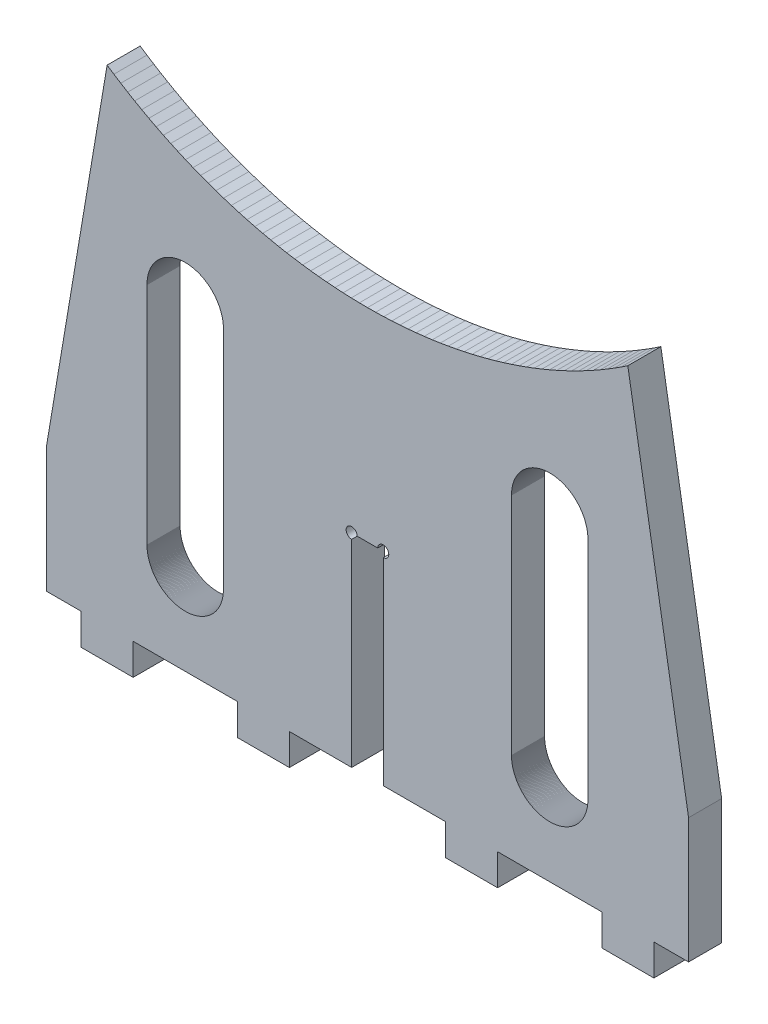
from build123d import *

# Parameters (mm, degrees)
BOSS_EXTRUDE1_DEPTH = 19.05


with BuildPart() as part:
    # Model → Boss-Extrude1 (new body)
    with BuildSketch(Plane.XY):
        with BuildLine():
            Line((4.683123656, 252.04098688), (0, 252))
            Line((0, 252), (-4.683123656, 252.04098688))
            Line((-4.683123656, 252.04098688), (-9.364812547, 252.163934964))
            Line((-9.364812547, 252.163934964), (-14.043632346, 252.368806584))
            Line((-14.043632346, 252.368806584), (-18.718149609, 252.655538974))
            Line((-18.718149609, 252.655538974), (-23.386932206, 253.024044287))
            Line((-23.386932206, 253.024044287), (-28.048549765, 253.474209626))
            Line((-28.048549765, 253.474209626), (-32.70157411, 254.005897072))
            Line((-32.70157411, 254.005897072), (-37.344579698, 254.618943734))
            Line((-37.344579698, 254.618943734), (-41.976144055, 255.313161793))
            Line((-41.976144055, 255.313161793), (-46.59484821, 256.088338561))
            Line((-46.59484821, 256.088338561), (-51.199277136, 256.944236549))
            Line((-51.199277136, 256.944236549), (-55.788020177, 257.880593536))
            Line((-55.788020177, 257.880593536), (-60.359671483, 258.89712265))
            Line((-60.359671483, 258.89712265), (-64.91283044, 259.993512458))
            Line((-64.91283044, 259.993512458), (-69.446102101, 261.16942706))
            Line((-69.446102101, 261.16942706), (-73.958097609, 262.424506193))
            Line((-73.958097609, 262.424506193), (-78.44743463, 263.758365338))
            Line((-78.44743463, 263.758365338), (-82.912737767, 265.170595841))
            Line((-82.912737767, 265.170595841), (-87.352638989, 266.66076504))
            Line((-87.352638989, 266.66076504), (-91.765778046, 268.228416391))
            Line((-91.765778046, 268.228416391), (-96.150802889, 269.873069615))
            Line((-96.150802889, 269.873069615), (-100.506370081, 271.59422084))
            Line((-100.506370081, 271.59422084), (-104.831145209, 273.391342758))
            Line((-104.831145209, 273.391342758), (-109.123803296, 275.263884788))
            Line((-109.123803296, 275.263884788), (-113.383029202, 277.211273238))
            Line((-113.383029202, 277.211273238), (-117.607518033, 279.23291149))
            Line((-117.607518033, 279.23291149), (-121.795975534, 281.328180175))
            Line((-121.795975534, 281.328180175), (-125.94711849, 283.496437368))
            Line((-125.94711849, 283.496437368), (-130.05967512, 285.737018781))
            Line((-130.05967512, 285.737018781), (-134.132385462, 288.049237969))
            Line((-134.132385462, 288.049237969), (-138.164001763, 290.432386539))
            Line((-138.164001763, 290.432386539), (-142.153288859, 292.885734367))
            Line((-142.153288859, 292.885734367), (-146.099024555, 295.408529823))
            Line((-146.099024555, 295.408529823), (-150, 298))
            Line((-150, 298), (-185, 90))
            Line((-185, 90), (-185, 18))
            Line((-185, 18), (-165, 18))
            Line((-165, 18), (-165, 0))
            Line((-165, 0), (-135, 0))
            Line((-135, 0), (-135, 18))
            Line((-135, 18), (-75, 18))
            Line((-75, 18), (-75, 0))
            Line((-75, 0), (-45, 0))
            Line((-45, 0), (-45, 18))
            Line((-45, 18), (-9.1, 18))
            Line((-9.1, 18), (-9.1, 131.825))
            ThreePointArc((-9.1, 131.825), (-11.34506403, 137.24506403), (-5.925, 135))
            Line((-5.925, 135), (5.925, 135))
            ThreePointArc((5.925, 135), (9.1, 138.175), (12.275, 135))
            ThreePointArc((12.275, 135), (11.34506403, 132.75493597), (9.1, 131.825))
            Line((9.1, 131.825), (9.1, 18))
            Line((9.1, 18), (45, 18))
            Line((45, 18), (45, 0))
            Line((45, 0), (75, 0))
            Line((75, 0), (75, 18))
            Line((75, 18), (135, 18))
            Line((135, 18), (135, 0))
            Line((135, 0), (165, 0))
            Line((165, 0), (165, 18))
            Line((165, 18), (185, 18))
            Line((185, 18), (185, 90))
            Line((185, 90), (150, 298))
            Line((150, 298), (146.099024555, 295.408529823))
            Line((146.099024555, 295.408529823), (142.153288859, 292.885734367))
            Line((142.153288859, 292.885734367), (138.164001763, 290.432386539))
            Line((138.164001763, 290.432386539), (134.132385462, 288.049237969))
            Line((134.132385462, 288.049237969), (130.05967512, 285.737018781))
            Line((130.05967512, 285.737018781), (125.94711849, 283.496437368))
            Line((125.94711849, 283.496437368), (121.795975534, 281.328180175))
            Line((121.795975534, 281.328180175), (117.607518033, 279.23291149))
            Line((117.607518033, 279.23291149), (113.383029202, 277.211273238))
            Line((113.383029202, 277.211273238), (109.123803296, 275.263884788))
            Line((109.123803296, 275.263884788), (104.831145209, 273.391342758))
            Line((104.831145209, 273.391342758), (100.506370081, 271.59422084))
            Line((100.506370081, 271.59422084), (96.150802889, 269.873069615))
            Line((96.150802889, 269.873069615), (91.765778046, 268.228416391))
            Line((91.765778046, 268.228416391), (87.352638989, 266.66076504))
            Line((87.352638989, 266.66076504), (82.912737767, 265.170595841))
            Line((82.912737767, 265.170595841), (78.44743463, 263.758365338))
            Line((78.44743463, 263.758365338), (73.958097609, 262.424506193))
            Line((73.958097609, 262.424506193), (69.446102101, 261.16942706))
            Line((69.446102101, 261.16942706), (64.91283044, 259.993512458))
            Line((64.91283044, 259.993512458), (60.359671483, 258.89712265))
            Line((60.359671483, 258.89712265), (55.788020177, 257.880593536))
            Line((55.788020177, 257.880593536), (51.199277136, 256.944236549))
            Line((51.199277136, 256.944236549), (46.59484821, 256.088338561))
            Line((46.59484821, 256.088338561), (41.976144055, 255.313161793))
            Line((41.976144055, 255.313161793), (37.344579698, 254.618943734))
            Line((37.344579698, 254.618943734), (32.70157411, 254.005897072))
            Line((32.70157411, 254.005897072), (28.048549765, 253.474209626))
            Line((28.048549765, 253.474209626), (23.386932206, 253.024044287))
            Line((23.386932206, 253.024044287), (18.718149609, 252.655538974))
            Line((18.718149609, 252.655538974), (14.043632346, 252.368806584))
            Line((14.043632346, 252.368806584), (9.364812547, 252.163934964))
            Line((9.364812547, 252.163934964), (4.683123656, 252.04098688))
        make_face()
        Polygon((-83.003350707, 200.383952942), (-83, 200), (-83, 70), (-83.003350707, 69.616047058), (-83.013401806, 69.232211073), (-83.030150235, 68.848608963), (-83.053590894, 68.465357578), (-83.083716642, 68.08257366), (-83.120518302, 67.700373808), (-83.163984664, 67.318874445), (-83.214102488, 66.938191779), (-83.270856507, 66.558441769), (-83.334229434, 66.179740091), (-83.404201964, 65.802202102), (-83.480752784, 65.425942802), (-83.563858575, 65.051076804), (-83.653494022, 64.677718297), (-83.749631822, 64.305981008), (-83.852242689, 63.935978172), (-83.961295369, 63.567822496), (-84.076756642, 63.201626124), (-84.198591337, 62.837500602), (-84.326762343, 62.475556847), (-84.461230617, 62.11590511), (-84.6019552, 61.758654945), (-84.748893224, 61.403915173), (-84.901999932, 61.051793852), (-85.061228685, 60.702398242), (-85.226530981, 60.355834771), (-85.397856468, 60.012209006), (-85.575152957, 59.671625619), (-85.758366443, 59.334188355), (-85.947441117, 59), (-86.142319385, 58.669162352), (-86.342941885, 58.341776187), (-86.549247505, 58.01794123), (-86.761173404, 57.697756124), (-86.978655026, 57.3813184), (-87.201626124, 57.06872445), (-87.430018779, 56.760069491), (-87.663763421, 56.455447543), (-87.902788848, 56.154951397), (-88.147022251, 55.858672587), (-88.396389235, 55.566701362), (-88.650813839, 55.27912666), (-88.910218564, 54.996036079), (-89.174524393, 54.71751585), (-89.443650814, 54.443650814), (-89.71751585, 54.174524393), (-89.996036079, 53.910218564), (-90.27912666, 53.650813839), (-90.566701362, 53.396389235), (-90.858672587, 53.147022251), (-91.154951397, 52.902788848), (-91.455447543, 52.663763421), (-91.760069491, 52.430018779), (-92.06872445, 52.201626124), (-92.3813184, 51.978655026), (-92.697756124, 51.761173404), (-93.01794123, 51.549247505), (-93.341776187, 51.342941885), (-93.669162352, 51.142319385), (-94, 50.947441117), (-94.334188355, 50.758366443), (-94.671625619, 50.575152957), (-95.012209006, 50.397856468), (-95.355834771, 50.226530981), (-95.702398242, 50.061228685), (-96.051793852, 49.901999932), (-96.403915173, 49.748893224), (-96.758654945, 49.6019552), (-97.11590511, 49.461230617), (-97.475556847, 49.326762343), (-97.837500602, 49.198591337), (-98.201626124, 49.076756642), (-98.567822496, 48.961295369), (-98.935978172, 48.852242689), (-99.305981008, 48.749631822), (-99.677718297, 48.653494022), (-100.051076804, 48.563858575), (-100.425942802, 48.480752784), (-100.802202102, 48.404201964), (-101.179740091, 48.334229434), (-101.558441769, 48.270856507), (-101.938191779, 48.214102488), (-102.318874445, 48.163984664), (-102.700373808, 48.120518302), (-103.08257366, 48.083716642), (-103.465357578, 48.053590894), (-103.848608963, 48.030150235), (-104.232211073, 48.013401806), (-104.616047058, 48.003350707), (-105, 48), (-105.383952942, 48.003350707), (-105.767788927, 48.013401806), (-106.151391037, 48.030150235), (-106.534642422, 48.053590894), (-106.91742634, 48.083716642), (-107.299626192, 48.120518302), (-107.681125555, 48.163984664), (-108.061808221, 48.214102488), (-108.441558231, 48.270856507), (-108.820259909, 48.334229434), (-109.197797898, 48.404201964), (-109.574057198, 48.480752784), (-109.948923196, 48.563858575), (-110.322281703, 48.653494022), (-110.694018992, 48.749631822), (-111.064021828, 48.852242689), (-111.432177504, 48.961295369), (-111.798373876, 49.076756642), (-112.162499398, 49.198591337), (-112.524443153, 49.326762343), (-112.88409489, 49.461230617), (-113.241345055, 49.6019552), (-113.596084827, 49.748893224), (-113.948206148, 49.901999932), (-114.297601758, 50.061228685), (-114.644165229, 50.226530981), (-114.987790994, 50.397856468), (-115.328374381, 50.575152957), (-115.665811645, 50.758366443), (-116, 50.947441117), (-116.330837648, 51.142319385), (-116.658223813, 51.342941885), (-116.98205877, 51.549247505), (-117.302243876, 51.761173404), (-117.6186816, 51.978655026), (-117.93127555, 52.201626124), (-118.239930509, 52.430018779), (-118.544552457, 52.663763421), (-118.845048603, 52.902788848), (-119.141327413, 53.147022251), (-119.433298638, 53.396389235), (-119.72087334, 53.650813839), (-120.003963921, 53.910218564), (-120.28248415, 54.174524393), (-120.556349186, 54.443650814), (-120.825475607, 54.71751585), (-121.089781436, 54.996036079), (-121.349186161, 55.27912666), (-121.603610765, 55.566701362), (-121.852977749, 55.858672587), (-122.097211152, 56.154951397), (-122.336236579, 56.455447543), (-122.569981221, 56.760069491), (-122.798373876, 57.06872445), (-123.021344974, 57.3813184), (-123.238826596, 57.697756124), (-123.450752495, 58.01794123), (-123.657058115, 58.341776187), (-123.857680615, 58.669162352), (-124.052558883, 59), (-124.241633557, 59.334188355), (-124.424847043, 59.671625619), (-124.602143532, 60.012209006), (-124.773469019, 60.355834771), (-124.938771315, 60.702398242), (-125.098000068, 61.051793852), (-125.251106776, 61.403915173), (-125.3980448, 61.758654945), (-125.538769383, 62.11590511), (-125.673237657, 62.475556847), (-125.801408663, 62.837500602), (-125.923243358, 63.201626124), (-126.038704631, 63.567822496), (-126.147757311, 63.935978172), (-126.250368178, 64.305981008), (-126.346505978, 64.677718297), (-126.436141425, 65.051076804), (-126.519247216, 65.425942802), (-126.595798036, 65.802202102), (-126.665770566, 66.179740091), (-126.729143493, 66.558441769), (-126.785897512, 66.938191779), (-126.836015336, 67.318874445), (-126.879481698, 67.700373808), (-126.916283358, 68.08257366), (-126.946409106, 68.465357578), (-126.969849765, 68.848608963), (-126.986598194, 69.232211073), (-126.996649293, 69.616047058), (-127, 70), (-127, 200), (-126.996649293, 200.383952942), (-126.986598194, 200.767788927), (-126.969849765, 201.151391037), (-126.946409106, 201.534642422), (-126.916283358, 201.91742634), (-126.879481698, 202.299626192), (-126.836015336, 202.681125555), (-126.785897512, 203.061808221), (-126.729143493, 203.441558231), (-126.665770566, 203.820259909), (-126.595798036, 204.197797898), (-126.519247216, 204.574057198), (-126.436141425, 204.948923196), (-126.346505978, 205.322281703), (-126.250368178, 205.694018992), (-126.147757311, 206.064021828), (-126.038704631, 206.432177504), (-125.923243358, 206.798373876), (-125.801408663, 207.162499398), (-125.673237657, 207.524443153), (-125.538769383, 207.88409489), (-125.3980448, 208.241345055), (-125.251106776, 208.596084827), (-125.098000068, 208.948206148), (-124.938771315, 209.297601758), (-124.773469019, 209.644165229), (-124.602143532, 209.987790994), (-124.424847043, 210.328374381), (-124.241633557, 210.665811645), (-124.052558883, 211), (-123.857680615, 211.330837648), (-123.657058115, 211.658223813), (-123.450752495, 211.98205877), (-123.238826596, 212.302243876), (-123.021344974, 212.6186816), (-122.798373876, 212.93127555), (-122.569981221, 213.239930509), (-122.336236579, 213.544552457), (-122.097211152, 213.845048603), (-121.852977749, 214.141327413), (-121.603610765, 214.433298638), (-121.349186161, 214.72087334), (-121.089781436, 215.003963921), (-120.825475607, 215.28248415), (-120.556349186, 215.556349186), (-120.28248415, 215.825475607), (-120.003963921, 216.089781436), (-119.72087334, 216.349186161), (-119.433298638, 216.603610765), (-119.141327413, 216.852977749), (-118.845048603, 217.097211152), (-118.544552457, 217.336236579), (-118.239930509, 217.569981221), (-117.93127555, 217.798373876), (-117.6186816, 218.021344974), (-117.302243876, 218.238826596), (-116.98205877, 218.450752495), (-116.658223813, 218.657058115), (-116.330837648, 218.857680615), (-116, 219.052558883), (-115.665811645, 219.241633557), (-115.328374381, 219.424847043), (-114.987790994, 219.602143532), (-114.644165229, 219.773469019), (-114.297601758, 219.938771315), (-113.948206148, 220.098000068), (-113.596084827, 220.251106776), (-113.241345055, 220.3980448), (-112.88409489, 220.538769383), (-112.524443153, 220.673237657), (-112.162499398, 220.801408663), (-111.798373876, 220.923243358), (-111.432177504, 221.038704631), (-111.064021828, 221.147757311), (-110.694018992, 221.250368178), (-110.322281703, 221.346505978), (-109.948923196, 221.436141425), (-109.574057198, 221.519247216), (-109.197797898, 221.595798036), (-108.820259909, 221.665770566), (-108.441558231, 221.729143493), (-108.061808221, 221.785897512), (-107.681125555, 221.836015336), (-107.299626192, 221.879481698), (-106.91742634, 221.916283358), (-106.534642422, 221.946409106), (-106.151391037, 221.969849765), (-105.767788927, 221.986598194), (-105.383952942, 221.996649293), (-105, 222), (-104.616047058, 221.996649293), (-104.232211073, 221.986598194), (-103.848608963, 221.969849765), (-103.465357578, 221.946409106), (-103.08257366, 221.916283358), (-102.700373808, 221.879481698), (-102.318874445, 221.836015336), (-101.938191779, 221.785897512), (-101.558441769, 221.729143493), (-101.179740091, 221.665770566), (-100.802202102, 221.595798036), (-100.425942802, 221.519247216), (-100.051076804, 221.436141425), (-99.677718297, 221.346505978), (-99.305981008, 221.250368178), (-98.935978172, 221.147757311), (-98.567822496, 221.038704631), (-98.201626124, 220.923243358), (-97.837500602, 220.801408663), (-97.475556847, 220.673237657), (-97.11590511, 220.538769383), (-96.758654945, 220.3980448), (-96.403915173, 220.251106776), (-96.051793852, 220.098000068), (-95.702398242, 219.938771315), (-95.355834771, 219.773469019), (-95.012209006, 219.602143532), (-94.671625619, 219.424847043), (-94.334188355, 219.241633557), (-94, 219.052558883), (-93.669162352, 218.857680615), (-93.341776187, 218.657058115), (-93.01794123, 218.450752495), (-92.697756124, 218.238826596), (-92.3813184, 218.021344974), (-92.06872445, 217.798373876), (-91.760069491, 217.569981221), (-91.455447543, 217.336236579), (-91.154951397, 217.097211152), (-90.858672587, 216.852977749), (-90.566701362, 216.603610765), (-90.27912666, 216.349186161), (-89.996036079, 216.089781436), (-89.71751585, 215.825475607), (-89.443650814, 215.556349186), (-89.174524393, 215.28248415), (-88.910218564, 215.003963921), (-88.650813839, 214.72087334), (-88.396389235, 214.433298638), (-88.147022251, 214.141327413), (-87.902788848, 213.845048603), (-87.663763421, 213.544552457), (-87.430018779, 213.239930509), (-87.201626124, 212.93127555), (-86.978655026, 212.6186816), (-86.761173404, 212.302243876), (-86.549247505, 211.98205877), (-86.342941885, 211.658223813), (-86.142319385, 211.330837648), (-85.947441117, 211), (-85.758366443, 210.665811645), (-85.575152957, 210.328374381), (-85.397856468, 209.987790994), (-85.226530981, 209.644165229), (-85.061228685, 209.297601758), (-84.901999932, 208.948206148), (-84.748893224, 208.596084827), (-84.6019552, 208.241345055), (-84.461230617, 207.88409489), (-84.326762343, 207.524443153), (-84.198591337, 207.162499398), (-84.076756642, 206.798373876), (-83.961295369, 206.432177504), (-83.852242689, 206.064021828), (-83.749631822, 205.694018992), (-83.653494022, 205.322281703), (-83.563858575, 204.948923196), (-83.480752784, 204.574057198), (-83.404201964, 204.197797898), (-83.334229434, 203.820259909), (-83.270856507, 203.441558231), (-83.214102488, 203.061808221), (-83.163984664, 202.681125555), (-83.120518302, 202.299626192), (-83.083716642, 201.91742634), (-83.053590894, 201.534642422), (-83.030150235, 201.151391037), (-83.013401806, 200.767788927), align=None, mode=Mode.SUBTRACT)
        Polygon((126.996649293, 200.383952942), (127, 200), (127, 70), (126.996649293, 69.616047058), (126.986598194, 69.232211073), (126.969849765, 68.848608963), (126.946409106, 68.465357578), (126.916283358, 68.08257366), (126.879481698, 67.700373808), (126.836015336, 67.318874445), (126.785897512, 66.938191779), (126.729143493, 66.558441769), (126.665770566, 66.179740091), (126.595798036, 65.802202102), (126.519247216, 65.425942802), (126.436141425, 65.051076804), (126.346505978, 64.677718297), (126.250368178, 64.305981008), (126.147757311, 63.935978172), (126.038704631, 63.567822496), (125.923243358, 63.201626124), (125.801408663, 62.837500602), (125.673237657, 62.475556847), (125.538769383, 62.11590511), (125.3980448, 61.758654945), (125.251106776, 61.403915173), (125.098000068, 61.051793852), (124.938771315, 60.702398242), (124.773469019, 60.355834771), (124.602143532, 60.012209006), (124.424847043, 59.671625619), (124.241633557, 59.334188355), (124.052558883, 59), (123.857680615, 58.669162352), (123.657058115, 58.341776187), (123.450752495, 58.01794123), (123.238826596, 57.697756124), (123.021344974, 57.3813184), (122.798373876, 57.06872445), (122.569981221, 56.760069491), (122.336236579, 56.455447543), (122.097211152, 56.154951397), (121.852977749, 55.858672587), (121.603610765, 55.566701362), (121.349186161, 55.27912666), (121.089781436, 54.996036079), (120.825475607, 54.71751585), (120.556349186, 54.443650814), (120.28248415, 54.174524393), (120.003963921, 53.910218564), (119.72087334, 53.650813839), (119.433298638, 53.396389235), (119.141327413, 53.147022251), (118.845048603, 52.902788848), (118.544552457, 52.663763421), (118.239930509, 52.430018779), (117.93127555, 52.201626124), (117.6186816, 51.978655026), (117.302243876, 51.761173404), (116.98205877, 51.549247505), (116.658223813, 51.342941885), (116.330837648, 51.142319385), (116, 50.947441117), (115.665811645, 50.758366443), (115.328374381, 50.575152957), (114.987790994, 50.397856468), (114.644165229, 50.226530981), (114.297601758, 50.061228685), (113.948206148, 49.901999932), (113.596084827, 49.748893224), (113.241345055, 49.6019552), (112.88409489, 49.461230617), (112.524443153, 49.326762343), (112.162499398, 49.198591337), (111.798373876, 49.076756642), (111.432177504, 48.961295369), (111.064021828, 48.852242689), (110.694018992, 48.749631822), (110.322281703, 48.653494022), (109.948923196, 48.563858575), (109.574057198, 48.480752784), (109.197797898, 48.404201964), (108.820259909, 48.334229434), (108.441558231, 48.270856507), (108.061808221, 48.214102488), (107.681125555, 48.163984664), (107.299626192, 48.120518302), (106.91742634, 48.083716642), (106.534642422, 48.053590894), (106.151391037, 48.030150235), (105.767788927, 48.013401806), (105.383952942, 48.003350707), (105, 48), (104.616047058, 48.003350707), (104.232211073, 48.013401806), (103.848608963, 48.030150235), (103.465357578, 48.053590894), (103.08257366, 48.083716642), (102.700373808, 48.120518302), (102.318874445, 48.163984664), (101.938191779, 48.214102488), (101.558441769, 48.270856507), (101.179740091, 48.334229434), (100.802202102, 48.404201964), (100.425942802, 48.480752784), (100.051076804, 48.563858575), (99.677718297, 48.653494022), (99.305981008, 48.749631822), (98.935978172, 48.852242689), (98.567822496, 48.961295369), (98.201626124, 49.076756642), (97.837500602, 49.198591337), (97.475556847, 49.326762343), (97.11590511, 49.461230617), (96.758654945, 49.6019552), (96.403915173, 49.748893224), (96.051793852, 49.901999932), (95.702398242, 50.061228685), (95.355834771, 50.226530981), (95.012209006, 50.397856468), (94.671625619, 50.575152957), (94.334188355, 50.758366443), (94, 50.947441117), (93.669162352, 51.142319385), (93.341776187, 51.342941885), (93.01794123, 51.549247505), (92.697756124, 51.761173404), (92.3813184, 51.978655026), (92.06872445, 52.201626124), (91.760069491, 52.430018779), (91.455447543, 52.663763421), (91.154951397, 52.902788848), (90.858672587, 53.147022251), (90.566701362, 53.396389235), (90.27912666, 53.650813839), (89.996036079, 53.910218564), (89.71751585, 54.174524393), (89.443650814, 54.443650814), (89.174524393, 54.71751585), (88.910218564, 54.996036079), (88.650813839, 55.27912666), (88.396389235, 55.566701362), (88.147022251, 55.858672587), (87.902788848, 56.154951397), (87.663763421, 56.455447543), (87.430018779, 56.760069491), (87.201626124, 57.06872445), (86.978655026, 57.3813184), (86.761173404, 57.697756124), (86.549247505, 58.01794123), (86.342941885, 58.341776187), (86.142319385, 58.669162352), (85.947441117, 59), (85.758366443, 59.334188355), (85.575152957, 59.671625619), (85.397856468, 60.012209006), (85.226530981, 60.355834771), (85.061228685, 60.702398242), (84.901999932, 61.051793852), (84.748893224, 61.403915173), (84.6019552, 61.758654945), (84.461230617, 62.11590511), (84.326762343, 62.475556847), (84.198591337, 62.837500602), (84.076756642, 63.201626124), (83.961295369, 63.567822496), (83.852242689, 63.935978172), (83.749631822, 64.305981008), (83.653494022, 64.677718297), (83.563858575, 65.051076804), (83.480752784, 65.425942802), (83.404201964, 65.802202102), (83.334229434, 66.179740091), (83.270856507, 66.558441769), (83.214102488, 66.938191779), (83.163984664, 67.318874445), (83.120518302, 67.700373808), (83.083716642, 68.08257366), (83.053590894, 68.465357578), (83.030150235, 68.848608963), (83.013401806, 69.232211073), (83.003350707, 69.616047058), (83, 70), (83, 200), (83.003350707, 200.383952942), (83.013401806, 200.767788927), (83.030150235, 201.151391037), (83.053590894, 201.534642422), (83.083716642, 201.91742634), (83.120518302, 202.299626192), (83.163984664, 202.681125555), (83.214102488, 203.061808221), (83.270856507, 203.441558231), (83.334229434, 203.820259909), (83.404201964, 204.197797898), (83.480752784, 204.574057198), (83.563858575, 204.948923196), (83.653494022, 205.322281703), (83.749631822, 205.694018992), (83.852242689, 206.064021828), (83.961295369, 206.432177504), (84.076756642, 206.798373876), (84.198591337, 207.162499398), (84.326762343, 207.524443153), (84.461230617, 207.88409489), (84.6019552, 208.241345055), (84.748893224, 208.596084827), (84.901999932, 208.948206148), (85.061228685, 209.297601758), (85.226530981, 209.644165229), (85.397856468, 209.987790994), (85.575152957, 210.328374381), (85.758366443, 210.665811645), (85.947441117, 211), (86.142319385, 211.330837648), (86.342941885, 211.658223813), (86.549247505, 211.98205877), (86.761173404, 212.302243876), (86.978655026, 212.6186816), (87.201626124, 212.93127555), (87.430018779, 213.239930509), (87.663763421, 213.544552457), (87.902788848, 213.845048603), (88.147022251, 214.141327413), (88.396389235, 214.433298638), (88.650813839, 214.72087334), (88.910218564, 215.003963921), (89.174524393, 215.28248415), (89.443650814, 215.556349186), (89.71751585, 215.825475607), (89.996036079, 216.089781436), (90.27912666, 216.349186161), (90.566701362, 216.603610765), (90.858672587, 216.852977749), (91.154951397, 217.097211152), (91.455447543, 217.336236579), (91.760069491, 217.569981221), (92.06872445, 217.798373876), (92.3813184, 218.021344974), (92.697756124, 218.238826596), (93.01794123, 218.450752495), (93.341776187, 218.657058115), (93.669162352, 218.857680615), (94, 219.052558883), (94.334188355, 219.241633557), (94.671625619, 219.424847043), (95.012209006, 219.602143532), (95.355834771, 219.773469019), (95.702398242, 219.938771315), (96.051793852, 220.098000068), (96.403915173, 220.251106776), (96.758654945, 220.3980448), (97.11590511, 220.538769383), (97.475556847, 220.673237657), (97.837500602, 220.801408663), (98.201626124, 220.923243358), (98.567822496, 221.038704631), (98.935978172, 221.147757311), (99.305981008, 221.250368178), (99.677718297, 221.346505978), (100.051076804, 221.436141425), (100.425942802, 221.519247216), (100.802202102, 221.595798036), (101.179740091, 221.665770566), (101.558441769, 221.729143493), (101.938191779, 221.785897512), (102.318874445, 221.836015336), (102.700373808, 221.879481698), (103.08257366, 221.916283358), (103.465357578, 221.946409106), (103.848608963, 221.969849765), (104.232211073, 221.986598194), (104.616047058, 221.996649293), (105, 222), (105.383952942, 221.996649293), (105.767788927, 221.986598194), (106.151391037, 221.969849765), (106.534642422, 221.946409106), (106.91742634, 221.916283358), (107.299626192, 221.879481698), (107.681125555, 221.836015336), (108.061808221, 221.785897512), (108.441558231, 221.729143493), (108.820259909, 221.665770566), (109.197797898, 221.595798036), (109.574057198, 221.519247216), (109.948923196, 221.436141425), (110.322281703, 221.346505978), (110.694018992, 221.250368178), (111.064021828, 221.147757311), (111.432177504, 221.038704631), (111.798373876, 220.923243358), (112.162499398, 220.801408663), (112.524443153, 220.673237657), (112.88409489, 220.538769383), (113.241345055, 220.3980448), (113.596084827, 220.251106776), (113.948206148, 220.098000068), (114.297601758, 219.938771315), (114.644165229, 219.773469019), (114.987790994, 219.602143532), (115.328374381, 219.424847043), (115.665811645, 219.241633557), (116, 219.052558883), (116.330837648, 218.857680615), (116.658223813, 218.657058115), (116.98205877, 218.450752495), (117.302243876, 218.238826596), (117.6186816, 218.021344974), (117.93127555, 217.798373876), (118.239930509, 217.569981221), (118.544552457, 217.336236579), (118.845048603, 217.097211152), (119.141327413, 216.852977749), (119.433298638, 216.603610765), (119.72087334, 216.349186161), (120.003963921, 216.089781436), (120.28248415, 215.825475607), (120.556349186, 215.556349186), (120.825475607, 215.28248415), (121.089781436, 215.003963921), (121.349186161, 214.72087334), (121.603610765, 214.433298638), (121.852977749, 214.141327413), (122.097211152, 213.845048603), (122.336236579, 213.544552457), (122.569981221, 213.239930509), (122.798373876, 212.93127555), (123.021344974, 212.6186816), (123.238826596, 212.302243876), (123.450752495, 211.98205877), (123.657058115, 211.658223813), (123.857680615, 211.330837648), (124.052558883, 211), (124.241633557, 210.665811645), (124.424847043, 210.328374381), (124.602143532, 209.987790994), (124.773469019, 209.644165229), (124.938771315, 209.297601758), (125.098000068, 208.948206148), (125.251106776, 208.596084827), (125.3980448, 208.241345055), (125.538769383, 207.88409489), (125.673237657, 207.524443153), (125.801408663, 207.162499398), (125.923243358, 206.798373876), (126.038704631, 206.432177504), (126.147757311, 206.064021828), (126.250368178, 205.694018992), (126.346505978, 205.322281703), (126.436141425, 204.948923196), (126.519247216, 204.574057198), (126.595798036, 204.197797898), (126.665770566, 203.820259909), (126.729143493, 203.441558231), (126.785897512, 203.061808221), (126.836015336, 202.681125555), (126.879481698, 202.299626192), (126.916283358, 201.91742634), (126.946409106, 201.534642422), (126.969849765, 201.151391037), (126.986598194, 200.767788927), align=None, mode=Mode.SUBTRACT)
    extrude(amount=BOSS_EXTRUDE1_DEPTH)


solid = part.part
